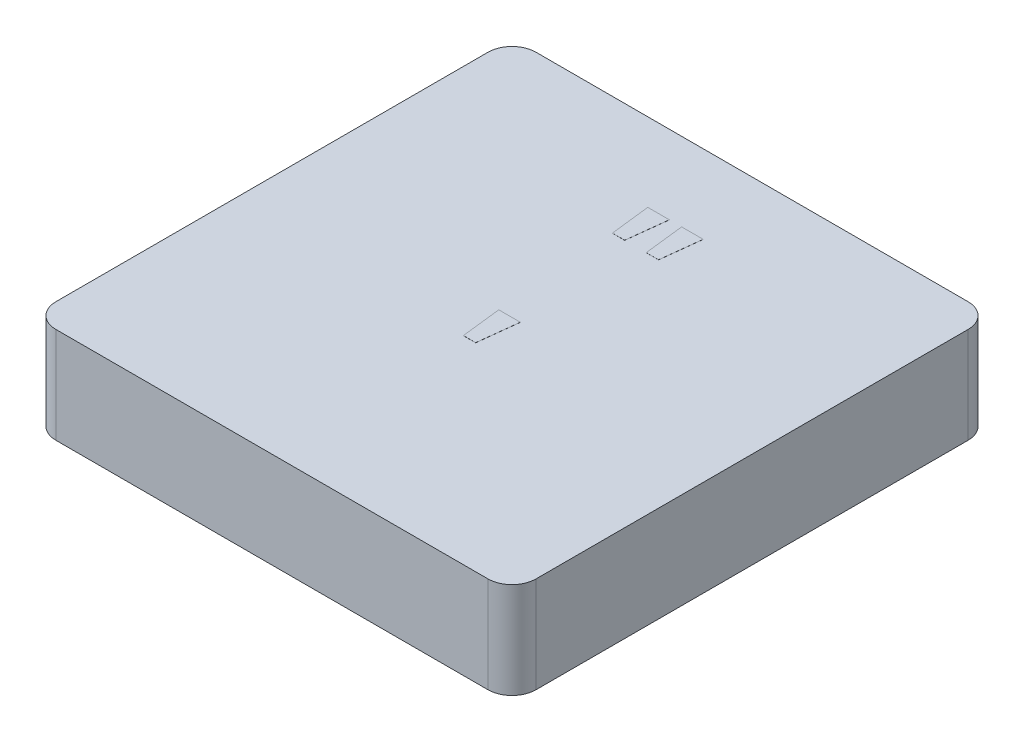
from build123d import *

# Parameters (mm, degrees)
SKETCH1_W           = 12.7
SKETCH1_H           = 12.7
BOSS_EXTRUDE1_DEPTH = 2.54
FILLET1_R           = 0.635
SHELL1_START        = 0.635
SHELL1_OUTLINE_W    = 1.905
SHELL1_OUTLINE_H    = 11.43
SHELL1_DEPTH        = 11.43
SKETCH2_R           = 2.54
BOSS_EXTRUDE2_DEPTH = 1.905
BOSS_EXTRUDE3_DEPTH = 0.00254


# Read off the part's stored shape, not the designer's step: Shell1
with BuildPart() as part:
    # Sketch1 → Boss-Extrude1 (new body)
    with BuildSketch(Plane(origin=(0, 0, 0), x_dir=(1, 0, 0), z_dir=(0, 1, 0))):
        with Locations((6.35, 6.35)):
            Rectangle(SKETCH1_W, SKETCH1_H)
    extrude(amount=BOSS_EXTRUDE1_DEPTH)

    # Fillet1
    fillet1_edges = [part.edges().sort_by_distance(p)[0] for p in [
        (0, 1.27, -12.7),
        (12.7, 1.27, -12.7),
        (12.7, 1.27, 0),
        (0, 1.27, 0),
    ]]
    fillet(fillet1_edges, radius=FILLET1_R)

    # Shell1 outline → Shell1 (cut)
    with BuildSketch(Plane.YZ.offset(SHELL1_START)):
        with Locations((0.9525, -6.35)):
            Rectangle(SHELL1_OUTLINE_W, SHELL1_OUTLINE_H)
    extrude(amount=SHELL1_DEPTH, mode=Mode.SUBTRACT)

    # Sketch2 → Boss-Extrude2 (add)
    with BuildSketch(Plane(origin=(0, 1.905, 0), x_dir=(-1, 0, 0), z_dir=(0, -1, 0))):
        with Locations(Location((-6.35, 6.35, 0), (0, 0, 270))):
            Circle(SKETCH2_R)
    extrude(amount=BOSS_EXTRUDE2_DEPTH)

    # Sketch3 → Boss-Extrude3 (add)
    with BuildSketch(Plane(origin=(0, 2.54, 0), x_dir=(1, 0, 0), z_dir=(0, 1, 0))):
        Polygon((7.012679487, 9.564076923), (6.687038462, 9.564076923), (6.564923077, 10.622410256), (7.134794872, 10.622410256), align=None)
        Polygon((6.117166667, 9.564076923), (5.791525641, 9.564076923), (5.669410256, 10.622410256), (6.239282051, 10.622410256), align=None)
        Polygon((6.493282051, 5.246076923), (6.167641026, 5.246076923), (6.045525641, 6.304410256), (6.615397436, 6.304410256), align=None)
    extrude(amount=BOSS_EXTRUDE3_DEPTH)


solid = part.part
